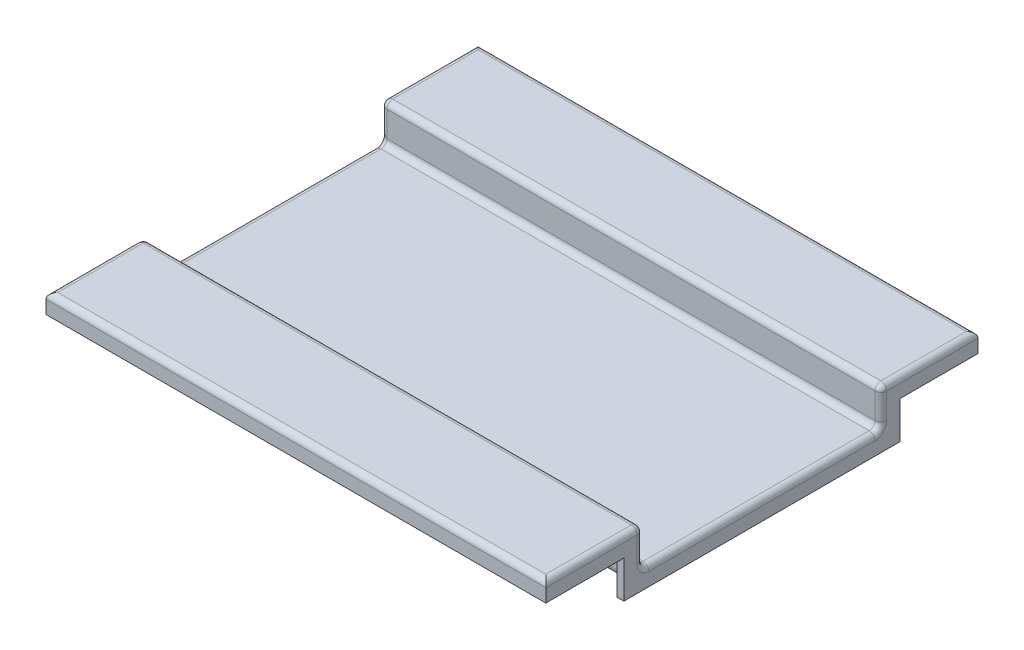
from build123d import *

# Parameters (mm, degrees)
CROQUIS2_W              = 170
CROQUIS2_H              = 147
SALIENTE_EXTRUIR1_DEPTH = 19.2
CROQUIS5_W              = 170
CROQUIS5_H              = 80.9
CORTAR_EXTRUIR1_DEPTH   = 12.7
CROQUIS6_W              = 26.55
CROQUIS6_H              = 12.7
CORTAR_EXTRUIR2_DEPTH   = 226.560723531
CROQUIS7_W              = 165.4
CROQUIS7_H              = 24.25
CORTAR_EXTRUIR4_DEPTH   = 3
CROQUIS8_W              = 165.4
CROQUIS8_H              = 15.7
CORTAR_EXTRUIR6_DEPTH   = 3
CROQUIS9_W              = 165.4
CROQUIS9_H              = 15.7
CORTAR_EXTRUIR7_DEPTH   = 3
CROQUIS10_W             = 165.4
CROQUIS10_H             = 87.9
CORTAR_EXTRUIR8_DEPTH   = 3
SALIENTE_EXTRUIR4_DEPTH = 18.7
CORTAR_EXTRUIR11_REACH  = 175.429
CORTAR_EXTRUIR13_REACH  = 175.429
CORTAR_EXTRUIR14_REACH  = 190.231
CROQUIS23_R             = 12.225
CROQUIS23_W             = 17.858147542
CROQUIS23_H             = 5.6
CROQUIS23_W_2           = 5.6
CROQUIS23_H_2           = 17.86
CORTAR_EXTRUIR15_DEPTH  = 18.7
REDONDEO1_R             = 2
REDONDEO2_R             = 2
REDONDEO4_R             = 2
REDONDEO5_R             = 2
REDONDEO6_R             = 2
REDONDEO7_R             = 1.1
REDONDEO8_R             = 1.1
REDONDEO9_R             = 1.1
REDONDEO10_R            = 1.1


with BuildPart() as part:
    # Croquis2 → Saliente-Extruir1 (new body)
    with BuildSketch(Plane(origin=(0, 0, 0), x_dir=(1, 0, 0), z_dir=(0, 1, 0))):
        with Locations((85, 73.5)):
            Rectangle(CROQUIS2_W, CROQUIS2_H)
    extrude(amount=SALIENTE_EXTRUIR1_DEPTH)

    # Croquis5 → Cortar-Extruir1 (cut)
    with BuildSketch(Plane(origin=(0, 19.2, 0), x_dir=(1, 0, 0), z_dir=(0, 1, 0))):
        with Locations((85, 73.5)):
            Rectangle(CROQUIS5_W, CROQUIS5_H)
    extrude(amount=-CORTAR_EXTRUIR1_DEPTH, mode=Mode.SUBTRACT)

    # Croquis6 → Cortar-Extruir2 (cut, through all)
    with BuildSketch(Plane(origin=(170, 0, 0), x_dir=(0, 0, -1), z_dir=(1, 0, 0))):
        with Locations((13.275, 6.35)):
            Rectangle(CROQUIS6_W, CROQUIS6_H)
        with Locations((133.725, 6.35)):
            Rectangle(CROQUIS6_W, CROQUIS6_H)
    extrude(amount=-CORTAR_EXTRUIR2_DEPTH, mode=Mode.SUBTRACT)

    # Croquis7 → Cortar-Extruir4 (cut)
    with BuildSketch(Plane.XZ.offset(-12.7)):
        with Locations((85, -132.575)):
            Rectangle(CROQUIS7_W, CROQUIS7_H)
        with Locations((85, -14.425)):
            Rectangle(CROQUIS7_W, CROQUIS7_H)
    extrude(amount=-CORTAR_EXTRUIR4_DEPTH, mode=Mode.SUBTRACT)

    # Croquis8 → Cortar-Extruir6 (cut)
    with BuildSketch(Plane.XY.offset(-26.55)):
        with Locations((85, 7.85)):
            Rectangle(CROQUIS8_W, CROQUIS8_H)
    extrude(amount=-CORTAR_EXTRUIR6_DEPTH, mode=Mode.SUBTRACT)

    # Croquis9 → Cortar-Extruir7 (cut)
    with BuildSketch(Plane(origin=(0, 0, -120.45), x_dir=(-1, 0, 0), z_dir=(0, 0, -1))):
        with Locations((-85, 7.85)):
            Rectangle(CROQUIS9_W, CROQUIS9_H)
    extrude(amount=-CORTAR_EXTRUIR7_DEPTH, mode=Mode.SUBTRACT)

    # Croquis10 → Cortar-Extruir8 (cut)
    with BuildSketch(Plane.XZ):
        with Locations((85, -73.5)):
            Rectangle(CROQUIS10_W, CROQUIS10_H)
    extrude(amount=-CORTAR_EXTRUIR8_DEPTH, mode=Mode.SUBTRACT)

    # Croquis15 → Saliente-Extruir4 (add)
    with BuildSketch(Plane.XZ.offset(-3)):
        with BuildLine():
            Line((80, -40.710908475), (90, -40.710908475))
            Line((90, -40.710908475), (90, -59.410908475))
            ThreePointArc((90, -59.410908475), (95.571246379, -62.928753621), (99.089091525, -68.5))
            Line((99.089091525, -68.5), (117.789091525, -68.5))
            Line((117.789091525, -68.5), (117.789091525, -78.5))
            Line((117.789091525, -78.5), (99.089091525, -78.5))
            ThreePointArc((99.089091525, -78.5), (95.571246379, -84.071246379), (90, -87.589091525))
            Line((90, -87.589091525), (90, -106.289091525))
            Line((90, -106.289091525), (80, -106.289091525))
            Line((80, -106.289091525), (80, -87.589091525))
            ThreePointArc((80, -87.589091525), (74.428753621, -84.071246379), (70.910908475, -78.5))
            Line((70.910908475, -78.5), (52.210908475, -78.5))
            Line((52.210908475, -78.5), (52.210908475, -68.5))
            Line((52.210908475, -68.5), (70.910908475, -68.5))
            ThreePointArc((70.910908475, -68.5), (74.428753621, -62.928753621), (80, -59.410908475))
            Line((80, -59.410908475), (80, -40.710908475))
        make_face()
    extrude(amount=SALIENTE_EXTRUIR4_DEPTH)

    # Croquis20 → Cortar-Extruir11 (cut, up to next)
    with BuildSketch(Plane(origin=(90, 0, 0), x_dir=(0, 0, -1), z_dir=(1, 0, 0)), mode=Mode.PRIVATE) as cortar_extruir11_sk1:
        Polygon((59.410908475, -15.7), (40.710908475, 3), (40.710908475, -15.7), align=None)
    cortar_extruir11_tool1 = extrude(cortar_extruir11_sk1.sketch, amount=-CORTAR_EXTRUIR11_REACH, mode=Mode.PRIVATE) & part.part
    add(cortar_extruir11_tool1.solids().sort_by_distance((90, -9.466667, -46.944242))[0], mode=Mode.SUBTRACT)

    # Croquis21 → Cortar-Extruir13 (cut, up to next)
    with BuildSketch(Plane(origin=(90, 0, 0), x_dir=(0, 0, -1), z_dir=(1, 0, 0)), mode=Mode.PRIVATE) as cortar_extruir13_sk1:
        Polygon((87.589091525, -15.7), (106.289091525, 3), (106.289091525, -15.7), align=None)
    cortar_extruir13_tool1 = extrude(cortar_extruir13_sk1.sketch, amount=-CORTAR_EXTRUIR13_REACH, mode=Mode.PRIVATE) & part.part
    add(cortar_extruir13_tool1.solids().sort_by_distance((90, -9.466667, -100.055758))[0], mode=Mode.SUBTRACT)

    # Croquis22 → Cortar-Extruir14 (cut, up to next)
    with BuildSketch(Plane(origin=(0, 0, -78.5), x_dir=(-1, 0, 0), z_dir=(0, 0, -1)), mode=Mode.PRIVATE) as cortar_extruir14_sk1:
        Polygon((-99.089091525, -15.7), (-117.789091525, 3), (-117.789091525, -15.7), align=None)
    cortar_extruir14_tool1 = extrude(cortar_extruir14_sk1.sketch, amount=-CORTAR_EXTRUIR14_REACH, mode=Mode.PRIVATE) & part.part
    # Croquis22 → Cortar-Extruir14 (cut, up to next)
    with BuildSketch(Plane(origin=(0, 0, -78.5), x_dir=(-1, 0, 0), z_dir=(0, 0, -1)), mode=Mode.PRIVATE) as cortar_extruir14_sk2:
        Polygon((-70.910908475, -15.7), (-52.210908475, -15.7), (-52.210908475, 3), align=None)
    cortar_extruir14_tool2 = extrude(cortar_extruir14_sk2.sketch, amount=-CORTAR_EXTRUIR14_REACH, mode=Mode.PRIVATE) & part.part
    add(cortar_extruir14_tool1.solids().sort_by_distance((111.555758, -9.466667, -78.5))[0], mode=Mode.SUBTRACT)
    add(cortar_extruir14_tool2.solids().sort_by_distance((58.444242, -9.466667, -78.5))[0], mode=Mode.SUBTRACT)

    # Croquis23 → Cortar-Extruir15 (cut)
    with BuildSketch(Plane.XZ.offset(15.7)):
        with Locations(Location((85, -73.5, 0), (0, 0, 270))):
            Circle(CROQUIS23_R)
        with Locations((61.139982246, -73.5)):
            Rectangle(CROQUIS23_W, CROQUIS23_H)
        with Locations((108.860017754, -73.5)):
            Rectangle(CROQUIS23_W, CROQUIS23_H)
        with Locations((85, -97.359091525)):
            Rectangle(CROQUIS23_W_2, CROQUIS23_H_2)
        with Locations((85, -49.640908475)):
            Rectangle(CROQUIS23_W_2, CROQUIS23_H_2)
    extrude(amount=-CORTAR_EXTRUIR15_DEPTH, mode=Mode.SUBTRACT)

    # Redondeo1
    redondeo1_edges = [part.edges().sort_by_distance(p)[0] for p in [
        (85, 3, -29.55),
        (85, 3, -117.45),
    ]]
    fillet(redondeo1_edges, radius=REDONDEO1_R)

    # Redondeo2
    redondeo2_edges = [part.edges().sort_by_distance(p)[0] for p in [
        (85, 6.5, -113.95),
        (85, 6.5, -33.05),
    ]]
    fillet(redondeo2_edges, radius=REDONDEO2_R)

    # Redondeo4
    redondeo4_edges = [part.edges().sort_by_distance(p)[0] for p in [
        (85, 19.2, -33.05),
        (85, 19.2, -113.95),
    ]]
    fillet(redondeo4_edges, radius=REDONDEO4_R)

    # Redondeo5
    redondeo5_edges = [part.edges().sort_by_distance(p)[0] for p in [
        (85, 15.7, -117.45),
        (85, 15.7, -29.55),
    ]]
    fillet(redondeo5_edges, radius=REDONDEO5_R)

    # Redondeo6
    redondeo6_edges = [part.edges().sort_by_distance(p)[0] for p in [
        (170, 19.2, -15.525),
        (85, 19.2, -147),
        (0, 6.5, -73.5),
        (170, 6.5, -73.5),
        (170, 12.85, -33.05),
        (0, 12.85, -33.05),
        (0, 12.85, -113.95),
        (170, 12.85, -113.95),
        (170, 7.085786438, -33.635786438),
        (0, 7.085786438, -33.635786438),
        (0, 7.085786438, -113.364213562),
        (170, 7.085786438, -113.364213562),
        (0, 19.2, -15.525),
        (0, 18.614213562, -32.464213562),
        (0, 18.614213562, -114.535786438),
        (170, 19.2, -131.475),
        (170, 18.614213562, -32.464213562),
        (170, 18.614213562, -114.535786438),
        (0, 19.2, -131.475),
        (85, 19.2, 0),
    ]]
    fillet(redondeo6_edges, radius=REDONDEO6_R)

    # Redondeo7
    # the kernel refuses this fillet: 1.1 mm, written as the material it takes off along each edge
    with BuildSketch(Plane(origin=(97.144547877, -17.644543648, -68.5), x_dir=(0, 0, -1), z_dir=(0.7071067811865476, 0.7071067811865475, 0))) as redondeo7_piece_1_section:
        with BuildLine():
            CenterArc((REDONDEO7_R, REDONDEO7_R), REDONDEO7_R, 180, 90)
            Line((0, REDONDEO7_R), (0, 0))
            Line((0, 0), (REDONDEO7_R, 0))
        make_face()
    redondeo7_piece_1 = extrude(amount=31.945793616, mode=Mode.PRIVATE)
    redondeo7_piece_1 = split(redondeo7_piece_1, bisect_by=Plane(origin=(108.309123909, 3, -68.746879787), z_dir=(0, -1, 0)), keep=Keep.TOP, mode=Mode.PRIVATE)
    redondeo7_piece_1 = redondeo7_piece_1 - Plane(origin=(85, -6.136505333, -73.5), x_dir=(0.33444816053512244, 0, 0.9424141488298406), z_dir=(0, 1, 0)) * Cylinder(14.95, 69, mode=Mode.PRIVATE)
    add(redondeo7_piece_1, mode=Mode.SUBTRACT)
    with BuildSketch(Plane(origin=(119.733635173, 4.944543648, -70.7), x_dir=(0, 0, 1), z_dir=(-0.7071067811865476, -0.7071067811865475, 1.6880684369159103e-15))) as redondeo7_piece_2_section:
        with BuildLine():
            CenterArc((REDONDEO7_R, REDONDEO7_R), REDONDEO7_R, 180, 90)
            Line((0, REDONDEO7_R), (0, 0))
            Line((0, 0), (REDONDEO7_R, 0))
        make_face()
    redondeo7_piece_2 = extrude(amount=30.755234452, mode=Mode.PRIVATE)
    redondeo7_piece_2 = split(redondeo7_piece_2, bisect_by=Plane(origin=(108.688707761, 3, -70.452274028), z_dir=(0, -1, 0)), keep=Keep.TOP, mode=Mode.PRIVATE)
    redondeo7_piece_2 = split(redondeo7_piece_2, bisect_by=Plane(origin=(99.930943983, -5.757763778, -70.452274028), z_dir=(1, 0, 0)), keep=Keep.TOP, mode=Mode.PRIVATE)
    add(redondeo7_piece_2, mode=Mode.SUBTRACT)

    # Redondeo8
    # the kernel refuses this fillet: 1.1 mm, written as the material it takes off along each edge
    with BuildSketch(Plane(origin=(97.986400335, -16.80269119, -76.3), x_dir=(-0.7071067811865474, 0.7071067811865476, 0), z_dir=(0.7071067811865476, 0.7071067811865475, -1.6880684369159103e-15))) as redondeo8_piece_1_section:
        with BuildLine():
            CenterArc((REDONDEO8_R, -REDONDEO8_R), REDONDEO8_R, 90, 90)
            Line((0, -REDONDEO8_R), (0, 0))
            Line((0, 0), (REDONDEO8_R, 0))
        make_face()
    redondeo8_piece_1 = extrude(amount=30.755234452, mode=Mode.PRIVATE)
    redondeo8_piece_1 = split(redondeo8_piece_1, bisect_by=Plane(origin=(108.688707761, 3, -76.547725972), z_dir=(0, -1, 0)), keep=Keep.TOP, mode=Mode.PRIVATE)
    redondeo8_piece_1 = split(redondeo8_piece_1, bisect_by=Plane(origin=(99.930943983, -5.757763778, -76.547725972), z_dir=(1, 0, 0)), keep=Keep.TOP, mode=Mode.PRIVATE)
    add(redondeo8_piece_1, mode=Mode.SUBTRACT)
    with BuildSketch(Plane(origin=(97.144547877, -17.644543648, -78.5), x_dir=(0, 0, 1), z_dir=(0.7071067811865476, 0.7071067811865475, 0))) as redondeo8_piece_2_section:
        with BuildLine():
            CenterArc((REDONDEO8_R, -REDONDEO8_R), REDONDEO8_R, 90, 90)
            Line((0, -REDONDEO8_R), (0, 0))
            Line((0, 0), (REDONDEO8_R, 0))
        make_face()
    redondeo8_piece_2 = extrude(amount=31.945793616, mode=Mode.PRIVATE)
    redondeo8_piece_2 = split(redondeo8_piece_2, bisect_by=Plane(origin=(108.309118879, 3, -78.253120023), z_dir=(0, -1, 0)), keep=Keep.TOP, mode=Mode.PRIVATE)
    redondeo8_piece_2 = redondeo8_piece_2 - Plane(origin=(85, -6.136509494, -73.5), x_dir=(0.9424141488298422, 0, -0.334448160535118), z_dir=(0, 1, 0)) * Cylinder(14.95, 69, mode=Mode.PRIVATE)
    add(redondeo8_piece_2, mode=Mode.SUBTRACT)

    # Redondeo9
    # the kernel refuses this fillet: 1.1 mm, written as the material it takes off along each edge
    with BuildSketch(Plane(origin=(80, -17.644543648, -85.644547877), x_dir=(-1.2918958832001881e-14, 0.7071067811865472, 0.7071067811865477), z_dir=(2.1494313872890156e-15, 0.7071067811865478, -0.7071067811865474))) as redondeo9_piece_1_section:
        with BuildLine():
            CenterArc((REDONDEO9_R, REDONDEO9_R), REDONDEO9_R, 180, 90)
            Line((0, REDONDEO9_R), (0, 0))
            Line((0, 0), (REDONDEO9_R, 0))
        make_face()
    redondeo9_piece_1 = extrude(amount=31.945793616, mode=Mode.PRIVATE)
    redondeo9_piece_1 = split(redondeo9_piece_1, bisect_by=Plane(origin=(80.246879219, 3, -96.809136039), z_dir=(0, -1, 0)), keep=Keep.TOP, mode=Mode.PRIVATE)
    redondeo9_piece_1 = redondeo9_piece_1 - Plane(origin=(85, -6.136493377, -73.5), x_dir=(-0.33444816053511944, 0, -0.9424141488298416), z_dir=(0, 1, 0)) * Cylinder(14.95, 69, mode=Mode.PRIVATE)
    add(redondeo9_piece_1, mode=Mode.SUBTRACT)
    with BuildSketch(Plane(origin=(82.2, 4.944543648, -108.233635173), x_dir=(-1, 0, 0), z_dir=(0, -0.7071067811865478, 0.7071067811865474))) as redondeo9_piece_2_section:
        with BuildLine():
            CenterArc((REDONDEO9_R, -REDONDEO9_R), REDONDEO9_R, 90, 90)
            Line((0, -REDONDEO9_R), (0, 0))
            Line((0, 0), (REDONDEO9_R, 0))
        make_face()
    redondeo9_piece_2 = extrude(amount=30.757854224, mode=Mode.PRIVATE)
    redondeo9_piece_2 = split(redondeo9_piece_2, bisect_by=Plane(origin=(81.952274242, 3, -97.187781275), z_dir=(0, -1, 0)), keep=Keep.TOP, mode=Mode.PRIVATE)
    redondeo9_piece_2 = split(redondeo9_piece_2, bisect_by=Plane(origin=(81.952274242, -5.75868975, -88.429091525), z_dir=(0, 0, -1)), keep=Keep.TOP, mode=Mode.PRIVATE)
    add(redondeo9_piece_2, mode=Mode.SUBTRACT)
    with BuildSketch(Plane(origin=(87.8, -16.804543648, -86.484547877), x_dir=(1, 0, 0), z_dir=(0, 0.7071067811865478, -0.7071067811865474))) as redondeo9_piece_3_section:
        with BuildLine():
            CenterArc((REDONDEO9_R, -REDONDEO9_R), REDONDEO9_R, 90, 90)
            Line((0, -REDONDEO9_R), (0, 0))
            Line((0, 0), (REDONDEO9_R, 0))
        make_face()
    redondeo9_piece_3 = extrude(amount=30.757854224, mode=Mode.PRIVATE)
    redondeo9_piece_3 = split(redondeo9_piece_3, bisect_by=Plane(origin=(88.047725758, 3, -97.187781275), z_dir=(0, -1, 0)), keep=Keep.TOP, mode=Mode.PRIVATE)
    redondeo9_piece_3 = split(redondeo9_piece_3, bisect_by=Plane(origin=(88.047725758, -5.75868975, -88.429091525), z_dir=(0, 0, -1)), keep=Keep.TOP, mode=Mode.PRIVATE)
    add(redondeo9_piece_3, mode=Mode.SUBTRACT)
    with BuildSketch(Plane(origin=(90, -17.644543648, -85.644547877), x_dir=(-1, 0, 0), z_dir=(1.049527044574716e-15, 0.7071067811865478, -0.7071067811865474))) as redondeo9_piece_4_section:
        with BuildLine():
            CenterArc((REDONDEO9_R, REDONDEO9_R), REDONDEO9_R, 180, 90)
            Line((0, REDONDEO9_R), (0, 0))
            Line((0, 0), (REDONDEO9_R, 0))
        make_face()
    redondeo9_piece_4 = extrude(amount=31.945793616, mode=Mode.PRIVATE)
    redondeo9_piece_4 = split(redondeo9_piece_4, bisect_by=Plane(origin=(89.753120213, 3, -96.80912391), z_dir=(0, -1, 0)), keep=Keep.TOP, mode=Mode.PRIVATE)
    redondeo9_piece_4 = redondeo9_piece_4 - Plane(origin=(85, -6.136505332, -73.5), x_dir=(0.9424141488298422, 0, -0.334448160535118), z_dir=(0, 1, 0)) * Cylinder(14.95, 69, mode=Mode.PRIVATE)
    add(redondeo9_piece_4, mode=Mode.SUBTRACT)

    # Redondeo10
    # the kernel refuses this fillet: 1.1 mm, written as the material it takes off along each edge
    with BuildSketch(Plane(origin=(90, -17.644543648, -61.355452123), x_dir=(-1, 0, 0), z_dir=(-1.5742905668620731e-15, 0.7071067811865474, 0.7071067811865478))) as redondeo10_piece_1_section:
        with BuildLine():
            CenterArc((REDONDEO10_R, -REDONDEO10_R), REDONDEO10_R, 90, 90)
            Line((0, -REDONDEO10_R), (0, 0))
            Line((0, 0), (REDONDEO10_R, 0))
        make_face()
    redondeo10_piece_1 = extrude(amount=31.945793616, mode=Mode.PRIVATE)
    redondeo10_piece_1 = split(redondeo10_piece_1, bisect_by=Plane(origin=(89.753120041, 3, -50.190880655), z_dir=(0, -1, 0)), keep=Keep.TOP, mode=Mode.PRIVATE)
    redondeo10_piece_1 = redondeo10_piece_1 - Plane(origin=(85, -6.136509083, -73.5), x_dir=(0.33444816053512244, 0, 0.9424141488298406), z_dir=(0, 1, 0)) * Cylinder(14.95, 69, mode=Mode.PRIVATE)
    add(redondeo10_piece_1, mode=Mode.SUBTRACT)
    with BuildSketch(Plane(origin=(87.8, -16.804543648, -60.515452123), x_dir=(1, 0, 0), z_dir=(0, 0.7071067811865474, 0.7071067811865478))) as redondeo10_piece_2_section:
        with BuildLine():
            CenterArc((REDONDEO10_R, REDONDEO10_R), REDONDEO10_R, 180, 90)
            Line((0, REDONDEO10_R), (0, 0))
            Line((0, 0), (REDONDEO10_R, 0))
        make_face()
    redondeo10_piece_2 = extrude(amount=30.757854224, mode=Mode.PRIVATE)
    redondeo10_piece_2 = split(redondeo10_piece_2, bisect_by=Plane(origin=(88.047725758, 3, -49.812218725), z_dir=(0, -1, 0)), keep=Keep.TOP, mode=Mode.PRIVATE)
    redondeo10_piece_2 = split(redondeo10_piece_2, bisect_by=Plane(origin=(88.047725758, -5.75868975, -58.570908475), z_dir=(0, 0, 1)), keep=Keep.TOP, mode=Mode.PRIVATE)
    add(redondeo10_piece_2, mode=Mode.SUBTRACT)
    with BuildSketch(Plane(origin=(82.2, 4.944543648, -38.766364827), x_dir=(-1, 0, 0), z_dir=(0, -0.7071067811865474, -0.7071067811865478))) as redondeo10_piece_3_section:
        with BuildLine():
            CenterArc((REDONDEO10_R, REDONDEO10_R), REDONDEO10_R, 180, 90)
            Line((0, REDONDEO10_R), (0, 0))
            Line((0, 0), (REDONDEO10_R, 0))
        make_face()
    redondeo10_piece_3 = extrude(amount=30.757854224, mode=Mode.PRIVATE)
    redondeo10_piece_3 = split(redondeo10_piece_3, bisect_by=Plane(origin=(81.952274242, 3, -49.812218725), z_dir=(0, -1, 0)), keep=Keep.TOP, mode=Mode.PRIVATE)
    redondeo10_piece_3 = split(redondeo10_piece_3, bisect_by=Plane(origin=(81.952274242, -5.75868975, -58.570908475), z_dir=(0, 0, 1)), keep=Keep.TOP, mode=Mode.PRIVATE)
    add(redondeo10_piece_3, mode=Mode.SUBTRACT)
    with BuildSketch(Plane(origin=(80, -17.644543648, -61.355452123), x_dir=(1, 0, 0), z_dir=(0, 0.7071067811865474, 0.7071067811865478))) as redondeo10_piece_4_section:
        with BuildLine():
            CenterArc((REDONDEO10_R, REDONDEO10_R), REDONDEO10_R, 180, 90)
            Line((0, REDONDEO10_R), (0, 0))
            Line((0, 0), (REDONDEO10_R, 0))
        make_face()
    redondeo10_piece_4 = extrude(amount=31.945793616, mode=Mode.PRIVATE)
    redondeo10_piece_4 = split(redondeo10_piece_4, bisect_by=Plane(origin=(80.246879787, 3, -50.19087609), z_dir=(0, -1, 0)), keep=Keep.TOP, mode=Mode.PRIVATE)
    redondeo10_piece_4 = redondeo10_piece_4 - Plane(origin=(85, -6.136505331, -73.5), x_dir=(-0.9424141488298411, 0, 0.33444816053512105), z_dir=(0, 1, 0)) * Cylinder(14.95, 69, mode=Mode.PRIVATE)
    add(redondeo10_piece_4, mode=Mode.SUBTRACT)
    with BuildSketch(Plane(origin=(50.266364827, 4.944543648, -68.5), x_dir=(0.7071067811865487, 0.7071067811865465, 0), z_dir=(0.7071067811865465, -0.7071067811865487, 0))) as redondeo10_piece_5_section:
        with BuildLine():
            CenterArc((REDONDEO10_R, -REDONDEO10_R), REDONDEO10_R, 90, 90)
            Line((0, -REDONDEO10_R), (0, 0))
            Line((0, 0), (REDONDEO10_R, 0))
        make_face()
    redondeo10_piece_5 = extrude(amount=31.945793616, mode=Mode.PRIVATE)
    redondeo10_piece_5 = split(redondeo10_piece_5, bisect_by=Plane(origin=(61.690863258, 3, -68.746879192), z_dir=(0, -1, 0)), keep=Keep.TOP, mode=Mode.PRIVATE)
    redondeo10_piece_5 = redondeo10_piece_5 - Plane(origin=(85, -6.136492758, -73.5), x_dir=(-0.9424141488298411, 0, 0.33444816053512105), z_dir=(0, 1, 0)) * Cylinder(14.95, 69, mode=Mode.PRIVATE)
    add(redondeo10_piece_5, mode=Mode.SUBTRACT)
    with BuildSketch(Plane(origin=(72.013599665, -16.80269119, -70.7), x_dir=(0, 0, 1), z_dir=(-0.7071067811865465, 0.7071067811865487, 0))) as redondeo10_piece_6_section:
        with BuildLine():
            CenterArc((REDONDEO10_R, REDONDEO10_R), REDONDEO10_R, 180, 90)
            Line((0, REDONDEO10_R), (0, 0))
            Line((0, 0), (REDONDEO10_R, 0))
        make_face()
    redondeo10_piece_6 = extrude(amount=30.755234452, mode=Mode.PRIVATE)
    redondeo10_piece_6 = split(redondeo10_piece_6, bisect_by=Plane(origin=(61.311292239, 3, -70.452274028), z_dir=(0, -1, 0)), keep=Keep.TOP, mode=Mode.PRIVATE)
    redondeo10_piece_6 = split(redondeo10_piece_6, bisect_by=Plane(origin=(70.069056017, -5.757763778, -70.452274028), z_dir=(-1, 0, 0)), keep=Keep.TOP, mode=Mode.PRIVATE)
    add(redondeo10_piece_6, mode=Mode.SUBTRACT)
    with BuildSketch(Plane(origin=(50.266364827, 4.944543648, -76.3), x_dir=(0, 0, -1), z_dir=(0.7071067811865465, -0.7071067811865487, 0))) as redondeo10_piece_7_section:
        with BuildLine():
            CenterArc((REDONDEO10_R, REDONDEO10_R), REDONDEO10_R, 180, 90)
            Line((0, REDONDEO10_R), (0, 0))
            Line((0, 0), (REDONDEO10_R, 0))
        make_face()
    redondeo10_piece_7 = extrude(amount=30.755234452, mode=Mode.PRIVATE)
    redondeo10_piece_7 = split(redondeo10_piece_7, bisect_by=Plane(origin=(61.311292239, 3, -76.547725972), z_dir=(0, -1, 0)), keep=Keep.TOP, mode=Mode.PRIVATE)
    redondeo10_piece_7 = split(redondeo10_piece_7, bisect_by=Plane(origin=(70.069056017, -5.757763778, -76.547725972), z_dir=(-1, 0, 0)), keep=Keep.TOP, mode=Mode.PRIVATE)
    add(redondeo10_piece_7, mode=Mode.SUBTRACT)
    with BuildSketch(Plane(origin=(50.266364827, 4.944543648, -78.5), x_dir=(0, 0, 1), z_dir=(0.7071067811865465, -0.7071067811865487, 0))) as redondeo10_piece_8_section:
        with BuildLine():
            CenterArc((REDONDEO10_R, -REDONDEO10_R), REDONDEO10_R, 90, 90)
            Line((0, -REDONDEO10_R), (0, 0))
            Line((0, 0), (REDONDEO10_R, 0))
        make_face()
    redondeo10_piece_8 = extrude(amount=31.945793616, mode=Mode.PRIVATE)
    redondeo10_piece_8 = split(redondeo10_piece_8, bisect_by=Plane(origin=(61.69087609, 3, -78.253120213), z_dir=(0, -1, 0)), keep=Keep.TOP, mode=Mode.PRIVATE)
    redondeo10_piece_8 = redondeo10_piece_8 - Plane(origin=(85, -6.136505332, -73.5), x_dir=(-0.33444816053511944, 0, -0.9424141488298416), z_dir=(0, 1, 0)) * Cylinder(14.95, 69, mode=Mode.PRIVATE)
    add(redondeo10_piece_8, mode=Mode.SUBTRACT)


solid = part.part
